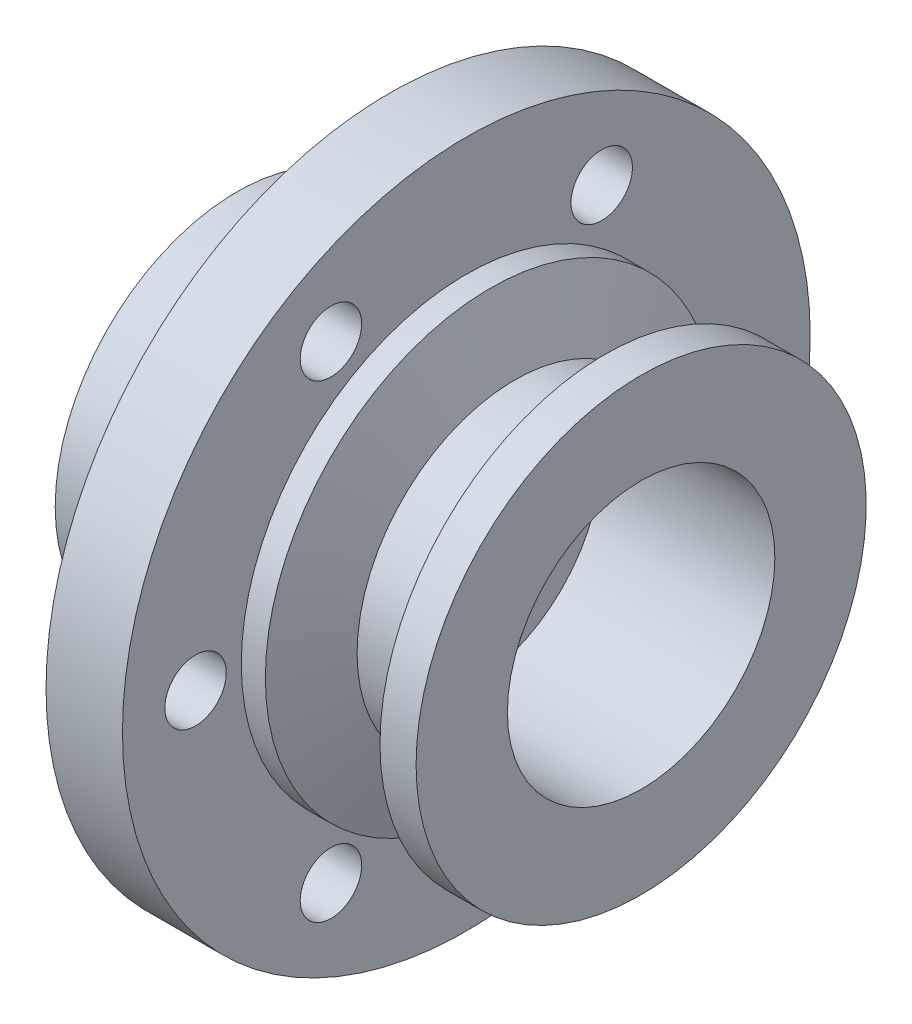
from build123d import *

# Parameters (mm, degrees)
F_1_4_20_TAPPED_HOLE1_D     = 5.1054
F_1_4_20_TAPPED_HOLE1_DEPTH = 16.51
F_1_4_20_TAPPED_HOLE1_TIP   = 1.533816902


with BuildPart() as part:
    # Sketch1 → Revolve1 (revolve)
    with BuildSketch(Plane.XY):
        Polygon((-12.7, 15.112500017), (0, 15.112500017), (0, 28.575), (6.35, 28.575), (6.35, 18.7005), (8.35, 18.7005), (10.383865669, 13.1125), (15.841134331, 13.1125), (17.875, 18.7005), (20.875, 18.7005), (20.875, 11.1125), (6.4125, 11.1125), (6.4125, 8.9375), (1.5875, 8.9375), (1.5875, 11.1125), (-12.7, 11.1125), align=None)
    revolve(axis=Axis((0, 0, 0), (1, 0, 0)))

    # 1/4-20 Tapped Hole1
    with Locations(Plane.ZY):
        with Locations((-11.25, -19.485571585), (-22.5, 0), (-11.25, 19.485571585), (11.25, 19.485571585), (22.5, 0), (11.25, -19.485571585)):
            Hole(F_1_4_20_TAPPED_HOLE1_D / 2, depth=F_1_4_20_TAPPED_HOLE1_DEPTH)
            with Locations((0, 0, -(F_1_4_20_TAPPED_HOLE1_DEPTH + F_1_4_20_TAPPED_HOLE1_TIP / 2))):  # 118° drill point
                Cone(0, F_1_4_20_TAPPED_HOLE1_D / 2, F_1_4_20_TAPPED_HOLE1_TIP, mode=Mode.SUBTRACT)


solid = part.part
